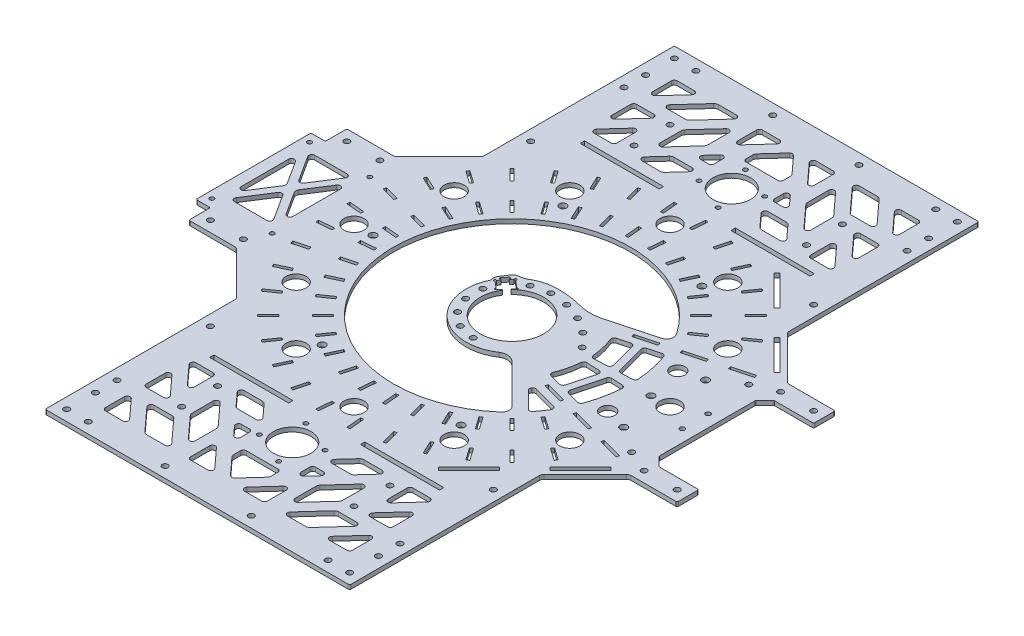
from build123d import *

# Parameters (mm, degrees)
EXTRUDE_2_OUTLINE_R   = 135
EXTRUDE_2_OUTLINE_R_2 = 2
EXTRUDE_2_OUTLINE_R_3 = 22.1
EXTRUDE_2_DEPTH       = 3
SKETCH_7_R            = 2.5
CUT_EXTRUDE_3_DEPTH   = 191.942399692
EXTRUDE_START         = -3
SKETCH_8_R            = 2
SKETCH_8_R_2          = 1.5
EXTRUDE_3_DEPTH       = 3
SKETCH_9_R            = 1.5
SKETCH_9_R_2          = 7
SKETCH_9_R_3          = 2.5
SKETCH_9_R_4          = 5
SKETCH_9_R_5          = 1.65
SKETCH_9_R_6          = 13.1
CUT_EXTRUDE_4_DEPTH   = 284.496031718
SKETCH_11_R           = 2
CUT_EXTRUDE_6_DEPTH   = 284.496031718
EXTRUDE_4_DEPTH       = 3
SKETCH_13_R           = 2
SKETCH_13_W           = 55
SKETCH_13_H           = 3
CUT_EXTRUDE_7_DEPTH   = 284.496031718
SKETCH_25_W           = 36
SKETCH_25_H           = 56
CUT_EXTRUDE_14_DEPTH  = 284.496031718
EXTRUDE_1_DEPTH       = 3
CUT_EXTRUDE_15_DEPTH  = 10
SKETCH_30_R           = 0.75
CUT_EXTRUDE_16_DEPTH  = 10
FILLET_1_R            = 3
FILLET_6_R            = 1
FILLET_8_R            = 2


with BuildPart() as part:
    # 凸台-拉伸2: read off the stored shape, not the designer's step
    # 凸台-拉伸2 outline → 凸台-拉伸2 (new body)
    with BuildSketch(Plane(origin=(0, 0, 0), x_dir=(1, 0, 0), z_dir=(0, 1, 0))):
        Circle(EXTRUDE_2_OUTLINE_R)
        with Locations((-11.714860956, -24.326159433)):
            Circle(EXTRUDE_2_OUTLINE_R_2, mode=Mode.SUBTRACT)
        with Locations((-21.109450027, -16.83422465)):
            Circle(EXTRUDE_2_OUTLINE_R_2, mode=Mode.SUBTRACT)
        with Locations((-26.323053629, -6.008065217)):
            Circle(EXTRUDE_2_OUTLINE_R_2, mode=Mode.SUBTRACT)
        with Locations((0, -27)):
            Circle(EXTRUDE_2_OUTLINE_R_2, mode=Mode.SUBTRACT)
        with Locations((-26.323053629, 6.008065217)):
            Circle(EXTRUDE_2_OUTLINE_R_2, mode=Mode.SUBTRACT)
        with Locations((-11.714860956, 24.326159433)):
            Circle(EXTRUDE_2_OUTLINE_R_2, mode=Mode.SUBTRACT)
        Circle(EXTRUDE_2_OUTLINE_R_3, mode=Mode.SUBTRACT)
        with Locations((0, 27)):
            Circle(EXTRUDE_2_OUTLINE_R_2, mode=Mode.SUBTRACT)
        with Locations((12.540402558, 25.523692784)):
            Circle(EXTRUDE_2_OUTLINE_R_2, mode=Mode.SUBTRACT)
        with Locations((24.405378925, 21.203563722)):
            Circle(EXTRUDE_2_OUTLINE_R_2, mode=Mode.SUBTRACT)
        with Locations((43.69592095, 5.163960916)):
            Circle(EXTRUDE_2_OUTLINE_R_2, mode=Mode.SUBTRACT)
        with Locations((34.97553353, 14.296103193)):
            Circle(EXTRUDE_2_OUTLINE_R_2, mode=Mode.SUBTRACT)
    extrude(amount=EXTRUDE_2_DEPTH)

    # 草图7 → 切除-拉伸3 (cut, through all)
    with BuildSketch(Plane(origin=(0, 3, 0), x_dir=(1, 0, 0), z_dir=(0, 1, 0))):
        with Locations(Location((96.75, 0, 0), (0, 0, 270))):
            Circle(SKETCH_7_R)
        with Locations(Location((48.375, -83.787957816, 0), (0, 0, 270))):
            Circle(SKETCH_7_R)
        with Locations(Location((-48.375, -83.787957816, 0), (0, 0, 270))):
            Circle(SKETCH_7_R)
        with Locations(Location((-96.75, 0, 0), (0, 0, 270))):
            Circle(SKETCH_7_R)
        with Locations(Location((-48.375, 83.787957816, 0), (0, 0, 270))):
            Circle(SKETCH_7_R)
        with Locations(Location((48.375, 83.787957816, 0), (0, 0, 270))):
            Circle(SKETCH_7_R)
        with BuildLine():
            Line((-23.944417996, 22.009220284), (-26.66858516, 18.812516785))
            Line((-26.66858516, 18.812516785), (-18.599424602, 11.936138592))
            ThreePointArc((-18.599424602, 11.936138592), (-17.380019908, 13.650820781), (-16.003077925, 15.241768169))
            Line((-16.003077925, 15.241768169), (-23.944417996, 22.009220284))
        make_face()
    extrude(amount=-CUT_EXTRUDE_3_DEPTH, mode=Mode.SUBTRACT)

    # 草图8 → 凸台-拉伸3 (add)
    # profile 1 of 4: a face of its own
    with BuildSketch(Plane(origin=(0, 3, 0), x_dir=(1, 0, 0), z_dir=(0, 1, 0)).offset(EXTRUDE_START)):
        with BuildLine():
            Line((123.288280059, 55), (170, 55))
            Line((170, 55), (170, 40))
            Line((170, 40), (142.5, 40))
            Line((142.5, 40), (136, 33.5))
            Line((136, 33.5), (136, -33.5))
            Line((136, -33.5), (142.5, -40))
            Line((142.5, -40), (170, -40))
            Line((170, -40), (170, -55))
            Line((170, -55), (123.288280059, -55))
            ThreePointArc((123.288280059, -55), (135, 0), (123.288280059, 55))
        make_face()
        with Locations(Location((162.5, 47.5, 0), (0, 0, 270))):
            Circle(SKETCH_8_R, mode=Mode.SUBTRACT)
        with Locations(Location((139.5, 47.5, 0), (0, 0, 270))):
            Circle(SKETCH_8_R, mode=Mode.SUBTRACT)
        with Locations(Location((139.5, -47.5, 0), (0, 0, 270))):
            Circle(SKETCH_8_R, mode=Mode.SUBTRACT)
        with Locations(Location((162.5, -47.5, 0), (0, 0, 270))):
            Circle(SKETCH_8_R, mode=Mode.SUBTRACT)
    # profile 2 of 4: a face of its own
    with BuildSketch(Plane(origin=(0, 3, 0), x_dir=(1, 0, 0), z_dir=(0, 1, 0)).offset(EXTRUDE_START)):
        with BuildLine():
            Line((-106, 83.600239234), (-106, 219))
            Line((-106, 219), (106, 219))
            Line((106, 219), (106, 83.600239234))
            ThreePointArc((106, 83.600239234), (0, 135), (-106, 83.600239234))
        make_face()
    # profile 3 of 4: a face of its own
    with BuildSketch(Plane(origin=(0, 3, 0), x_dir=(1, 0, 0), z_dir=(0, 1, 0)).offset(EXTRUDE_START)):
        with BuildLine():
            Line((106, -219), (106, -83.600239234))
            ThreePointArc((106, -83.600239234), (0, -135), (-106, -83.600239234))
            Line((-106, -83.600239234), (-106, -219))
            Line((-106, -219), (106, -219))
        make_face()
    # profile 4 of 4: a face of its own
    with BuildSketch(Plane(origin=(0, 3, 0), x_dir=(1, 0, 0), z_dir=(0, 1, 0)).offset(EXTRUDE_START)):
        with BuildLine():
            Line((-123.288280059, -55), (-170, -55))
            Line((-170, -55), (-170, -40))
            Line((-170, -40), (-180, -40))
            Line((-180, -40), (-180, 40))
            Line((-180, 40), (-170, 40))
            Line((-170, 40), (-170, 55))
            Line((-170, 55), (-123.288280059, 55))
            ThreePointArc((-123.288280059, 55), (-135, 0), (-123.288280059, -55))
        make_face()
        with Locations(Location((-162.5, -47.5, 0), (0, 0, 270))):
            Circle(SKETCH_8_R, mode=Mode.SUBTRACT)
        with Locations(Location((-139.5, -47.5, 0), (0, 0, 270))):
            Circle(SKETCH_8_R, mode=Mode.SUBTRACT)
        with Locations(Location((-139.5, 47.5, 0), (0, 0, 270))):
            Circle(SKETCH_8_R, mode=Mode.SUBTRACT)
        with Locations(Location((-162.5, 47.5, 0), (0, 0, 270))):
            Circle(SKETCH_8_R, mode=Mode.SUBTRACT)
        with Locations(Location((-175, 34, 0), (0, 0, 270))):
            Circle(SKETCH_8_R_2, mode=Mode.SUBTRACT)
        with Locations(Location((-175, -34, 0), (0, 0, 270))):
            Circle(SKETCH_8_R_2, mode=Mode.SUBTRACT)
        with Locations(Location((-133, -34, 0), (0, 0, 270))):
            Circle(SKETCH_8_R_2, mode=Mode.SUBTRACT)
        with Locations(Location((-133, 34, 0), (0, 0, 270))):
            Circle(SKETCH_8_R_2, mode=Mode.SUBTRACT)
    extrude(amount=EXTRUDE_3_DEPTH)

    # 草图9 → 切除-拉伸4 (cut, through all)
    with BuildSketch(Plane(origin=(0, 3, 0), x_dir=(1, 0, 0), z_dir=(0, 1, 0))):
        with Locations(Location((-6.696960066, 169.167891819, 0), (0, 0, 270))):
            Circle(SKETCH_9_R)
        with Locations(Location((0, 110, 0), (0, 0, 270))):
            Circle(SKETCH_9_R_2)
        with Locations(Location((106.251840892, 28.470094961, 0), (0, 0, 270))):
            Circle(SKETCH_9_R_3)
        with Locations(Location((55, 95.262794416, 0), (0, 0, 270))):
            Circle(SKETCH_9_R_2)
        with Locations(Location((91.038509128, 24.393695001, 0), (0, 0, 270))):
            Circle(SKETCH_9_R_4)
        with Locations(Location((91.038509128, -24.393695001, 0), (0, 0, 270))):
            Circle(SKETCH_9_R_4)
        with Locations(Location((106.251840892, -28.470094961, 0), (0, 0, 270))):
            Circle(SKETCH_9_R_3)
        with Locations(Location((95.262794416, 55, 0), (0, 0, 270))):
            Circle(SKETCH_9_R_2)
        with Locations(Location((110, 0, 0), (0, 0, 270))):
            Circle(SKETCH_9_R_2)
        with Locations(Location((95.262794416, -55, 0), (0, 0, 270))):
            Circle(SKETCH_9_R_2)
        with Locations(Location((55, -95.262794416, 0), (0, 0, 270))):
            Circle(SKETCH_9_R_2)
        with Locations(Location((0, -110, 0), (0, 0, 270))):
            Circle(SKETCH_9_R_2)
        with Locations(Location((-55, -95.262794416, 0), (0, 0, 270))):
            Circle(SKETCH_9_R_2)
        with Locations(Location((-95.262794416, -55, 0), (0, 0, 270))):
            Circle(SKETCH_9_R_2)
        with Locations(Location((-110, 0, 0), (0, 0, 270))):
            Circle(SKETCH_9_R_2)
        with Locations(Location((-95.262794416, 55, 0), (0, 0, 270))):
            Circle(SKETCH_9_R_2)
        with Locations(Location((-55, 95.262794416, 0), (0, 0, 270))):
            Circle(SKETCH_9_R_2)
        with Locations(Location((127.5, 9, 0), (0, 0, 270))):
            Circle(SKETCH_9_R_5)
        with Locations(Location((127.5, -9, 0), (0, 0, 270))):
            Circle(SKETCH_9_R_5)
        with Locations(Location((0, 153, 0), (0, 0, 270))):
            Circle(SKETCH_9_R_6)
        with Locations(Location((16.167891819, 159.696960066, 0), (0, 0, 270))):
            Circle(SKETCH_9_R)
        with Locations(Location((6.696960066, 136.832108181, 0), (0, 0, 270))):
            Circle(SKETCH_9_R)
        with Locations(Location((-16.167891819, 146.303039934, 0), (0, 0, 270))):
            Circle(SKETCH_9_R)
        with Locations(Location((-6.696960066, -136.832108181, 0), (0, 0, 270))):
            Circle(SKETCH_9_R)
        with Locations(Location((0, -153, 0), (0, 0, 270))):
            Circle(SKETCH_9_R_6)
        with Locations(Location((16.167891819, -146.303039934, 0), (0, 0, 270))):
            Circle(SKETCH_9_R)
        with Locations(Location((6.696960066, -169.167891819, 0), (0, 0, 270))):
            Circle(SKETCH_9_R)
        with Locations(Location((-16.167891819, -159.696960066, 0), (0, 0, 270))):
            Circle(SKETCH_9_R)
        with BuildLine():
            Line((33.521217387, 29.648283731), (65.703310504, 38.271449593))
            ThreePointArc((65.703310504, 38.271449593), (69.089351351, 41.341440596), (68.564648523, 45.88179348))
            ThreePointArc((68.564648523, 45.88179348), (-81.802671016, 10.703878487), (54.45114247, -61.978408205))
            ThreePointArc((54.45114247, -61.978408205), (56.148468382, -58.383515435), (54.686607136, -54.686607136))
            Line((54.686607136, -54.686607136), (27.712812921, -27.712812921))
            ThreePointArc((27.712812921, -27.712812921), (22.860030368, -25.410177947), (17.644766937, -26.695733736))
            ThreePointArc((17.644766937, -26.695733736), (-21.048434027, -24.103182881), (-28.829108868, 13.888213775))
            ThreePointArc((-28.829108868, 13.888213775), (-28.782435247, 14.075330073), (-28.814021115, 14.265575358))
            ThreePointArc((-28.814021115, 14.265575358), (-29.122939909, 16.594282895), (-28.334302935, 18.807055213))
            Line((-28.334302935, 18.807055213), (-25.048700438, 23.827495058))
            ThreePointArc((-25.048700438, 23.827495058), (-23.336585416, 25.435901649), (-21.078911577, 26.08491509))
            ThreePointArc((-21.078911577, 26.08491509), (-18.645378551, 26.493867679), (-16.386082739, 27.486292811))
            ThreePointArc((-16.386082739, 27.486292811), (-8.49819481, 30.850943016), (0, 32))
            ThreePointArc((0, 32), (9.091840642, 31.407048876), (18.029652224, 29.638240964))
            ThreePointArc((18.029652224, 29.638240964), (25.776094228, 28.626064824), (33.521217387, 29.648283731))
        make_face()
    extrude(amount=-CUT_EXTRUDE_4_DEPTH, mode=Mode.SUBTRACT)

    # 草图11 → 切除-拉伸6 (cut, through all)
    with BuildSketch(Plane(origin=(0, 3, 0), x_dir=(1, 0, 0), z_dir=(0, 1, 0))):
        with Locations(Location((124.017821778, -40.783850417, 0), (0, 0, 270))):
            Circle(SKETCH_11_R)
        with Locations(Location((124.017821778, 40.783850417, 0), (0, 0, 90))):
            Circle(SKETCH_11_R)
        Polygon((72.495125925, -49.540859067), (81.014307186, -55.506054005), (79.867154313, -57.144358094), (71.347973052, -51.179163156), align=None)
        Polygon((94.612231121, -65.027422849), (103.131412381, -70.992617787), (101.984259509, -72.630921875), (93.465078248, -66.665726937), align=None)
        Polygon((62.791082169, -61.376868607), (70.144992694, -68.730779131), (68.730779131, -70.144992694), (61.376868607, -62.791082169), align=None)
        Polygon((81.882965261, -80.468751699), (89.236875786, -87.822662223), (87.822662223, -89.236875786), (80.468751699, -81.882965261), align=None)
        Polygon((51.179163156, -71.347973052), (57.144358094, -79.867154313), (55.506054005, -81.014307186), (49.540859067, -72.495125925), align=None)
        Polygon((66.665726937, -93.465078248), (72.630921875, -101.984259509), (70.992617787, -103.131412381), (65.027422849, -94.612231121), align=None)
        Polygon((38.012191168, -79.15120544), (42.40742109, -88.576806425), (40.594805516, -89.422042949), (36.199575594, -79.996441964), align=None)
        Polygon((49.422884235, -103.62151569), (53.818114157, -113.047116675), (52.005498583, -113.892353199), (47.610268661, -104.466752214), align=None)
        Polygon((23.690237986, -84.549468503), (26.381956055, -94.595097096), (24.450104403, -95.112735187), (21.758386334, -85.067106593), align=None)
        Polygon((30.678352204, -110.629465813), (33.370070273, -120.675094406), (31.438218621, -121.192732496), (28.746500551, -111.147103903), align=None)
        Polygon((8.648468911, -87.37873875), (9.554888636, -97.73916361), (7.56249924, -97.913475095), (6.656079515, -87.553050235), align=None)
        Polygon((11.001673966, -114.275995598), (11.90809369, -124.636420458), (9.915704294, -124.810731944), (9.009284569, -114.450307084), align=None)
        Polygon((-6.656079515, -87.553050235), (-7.56249924, -97.913475095), (-9.554888636, -97.73916361), (-8.648468911, -87.37873875), align=None)
        Polygon((-9.009284569, -114.450307084), (-9.915704294, -124.810731944), (-11.90809369, -124.636420458), (-11.001673966, -114.275995598), align=None)
        Polygon((-21.758386334, -85.067106593), (-24.450104403, -95.112735187), (-26.381956055, -94.595097096), (-23.690237986, -84.549468503), align=None)
        Polygon((-28.746500551, -111.147103903), (-31.438218621, -121.192732496), (-33.370070273, -120.675094406), (-30.678352204, -110.629465813), align=None)
        Polygon((-36.199575594, -79.996441964), (-40.594805516, -89.422042949), (-42.40742109, -88.576806425), (-38.012191168, -79.15120544), align=None)
        Polygon((-47.610268661, -104.466752214), (-52.005498583, -113.892353199), (-53.818114157, -113.047116675), (-49.422884235, -103.62151569), align=None)
        Polygon((-49.540859067, -72.495125925), (-55.506054005, -81.014307186), (-57.144358094, -79.867154313), (-51.179163156, -71.347973052), align=None)
        Polygon((-65.027422849, -94.612231121), (-70.992617787, -103.131412381), (-72.630921875, -101.984259509), (-66.665726937, -93.465078248), align=None)
        Polygon((-61.376868607, -62.791082169), (-68.730779131, -70.144992694), (-70.144992694, -68.730779131), (-62.791082169, -61.376868607), align=None)
        Polygon((-80.468751699, -81.882965261), (-87.822662223, -89.236875786), (-89.236875786, -87.822662223), (-81.882965261, -80.468751699), align=None)
        Polygon((-71.347973052, -51.179163156), (-79.867154313, -57.144358094), (-81.014307186, -55.506054005), (-72.495125925, -49.540859067), align=None)
        Polygon((-93.465078248, -66.665726937), (-101.984259509, -72.630921875), (-103.131412381, -70.992617787), (-94.612231121, -65.027422849), align=None)
        Polygon((-79.15120544, -38.012191168), (-88.576806425, -42.40742109), (-89.422042949, -40.594805516), (-79.996441964, -36.199575594), align=None)
        Polygon((-103.62151569, -49.422884235), (-113.047116675, -53.818114157), (-113.892353199, -52.005498583), (-104.466752214, -47.610268661), align=None)
        Polygon((-84.549468503, -23.690237986), (-94.595097096, -26.381956055), (-95.112735187, -24.450104403), (-85.067106593, -21.758386334), align=None)
        Polygon((-110.629465813, -30.678352204), (-120.675094406, -33.370070273), (-121.192732496, -31.438218621), (-111.147103903, -28.746500551), align=None)
        Polygon((-87.37873875, -8.648468911), (-97.73916361, -9.554888636), (-97.913475095, -7.56249924), (-87.553050235, -6.656079515), align=None)
        Polygon((-114.275995598, -11.001673966), (-124.636420458, -11.90809369), (-124.810731944, -9.915704294), (-114.450307084, -9.009284569), align=None)
        Polygon((-87.553050235, 6.656079515), (-97.913475095, 7.56249924), (-97.73916361, 9.554888636), (-87.37873875, 8.648468911), align=None)
        Polygon((-114.450307084, 9.009284569), (-124.810731944, 9.915704294), (-124.636420458, 11.90809369), (-114.275995598, 11.001673966), align=None)
        Polygon((-85.067106593, 21.758386334), (-95.112735187, 24.450104403), (-94.595097096, 26.381956055), (-84.549468503, 23.690237986), align=None)
        Polygon((-111.147103903, 28.746500551), (-121.192732496, 31.438218621), (-120.675094406, 33.370070273), (-110.629465813, 30.678352204), align=None)
        Polygon((-79.996441964, 36.199575594), (-89.422042949, 40.594805516), (-88.576806425, 42.40742109), (-79.15120544, 38.012191168), align=None)
        Polygon((-104.466752214, 47.610268661), (-113.892353199, 52.005498583), (-113.047116675, 53.818114157), (-103.62151569, 49.422884235), align=None)
        Polygon((-72.495125925, 49.540859067), (-81.014307186, 55.506054005), (-79.867154313, 57.144358094), (-71.347973052, 51.179163156), align=None)
        Polygon((-94.612231121, 65.027422849), (-103.131412381, 70.992617787), (-101.984259509, 72.630921875), (-93.465078248, 66.665726937), align=None)
        Polygon((-62.791082169, 61.376868607), (-70.144992694, 68.730779131), (-68.730779131, 70.144992694), (-61.376868607, 62.791082169), align=None)
        Polygon((-81.882965261, 80.468751699), (-89.236875786, 87.822662223), (-87.822662223, 89.236875786), (-80.468751699, 81.882965261), align=None)
        Polygon((-51.179163156, 71.347973052), (-57.144358094, 79.867154313), (-55.506054005, 81.014307186), (-49.540859067, 72.495125925), align=None)
        Polygon((-66.665726937, 93.465078248), (-72.630921875, 101.984259509), (-70.992617787, 103.131412381), (-65.027422849, 94.612231121), align=None)
        Polygon((-38.012191168, 79.15120544), (-42.40742109, 88.576806425), (-40.594805516, 89.422042949), (-36.199575594, 79.996441964), align=None)
        Polygon((-49.422884235, 103.62151569), (-53.818114157, 113.047116675), (-52.005498583, 113.892353199), (-47.610268661, 104.466752214), align=None)
        Polygon((-23.690237986, 84.549468503), (-26.381956055, 94.595097096), (-24.450104403, 95.112735187), (-21.758386334, 85.067106593), align=None)
        Polygon((-30.678352204, 110.629465813), (-33.370070273, 120.675094406), (-31.438218621, 121.192732496), (-28.746500551, 111.147103903), align=None)
        Polygon((-8.648468911, 87.37873875), (-9.554888636, 97.73916361), (-7.56249924, 97.913475095), (-6.656079515, 87.553050235), align=None)
        Polygon((-11.001673966, 114.275995598), (-11.90809369, 124.636420458), (-9.915704294, 124.810731944), (-9.009284569, 114.450307084), align=None)
        Polygon((6.656079515, 87.553050235), (7.56249924, 97.913475095), (9.554888636, 97.73916361), (8.648468911, 87.37873875), align=None)
        Polygon((9.009284569, 114.450307084), (9.915704294, 124.810731944), (11.90809369, 124.636420458), (11.001673966, 114.275995598), align=None)
        Polygon((21.758386334, 85.067106593), (24.450104403, 95.112735187), (26.381956055, 94.595097096), (23.690237986, 84.549468503), align=None)
        Polygon((28.746500551, 111.147103903), (31.438218621, 121.192732496), (33.370070273, 120.675094406), (30.678352204, 110.629465813), align=None)
        Polygon((36.199575594, 79.996441964), (40.594805516, 89.422042949), (42.40742109, 88.576806425), (38.012191168, 79.15120544), align=None)
        Polygon((47.610268661, 104.466752214), (52.005498583, 113.892353199), (53.818114157, 113.047116675), (49.422884235, 103.62151569), align=None)
        Polygon((49.540859067, 72.495125925), (55.506054005, 81.014307186), (57.144358094, 79.867154313), (51.179163156, 71.347973052), align=None)
        Polygon((65.027422849, 94.612231121), (70.992617787, 103.131412381), (72.630921875, 101.984259509), (66.665726937, 93.465078248), align=None)
        Polygon((61.376868607, 62.791082169), (68.730779131, 70.144992694), (70.144992694, 68.730779131), (62.791082169, 61.376868607), align=None)
        Polygon((80.468751699, 81.882965261), (87.822662223, 89.236875786), (89.236875786, 87.822662223), (81.882965261, 80.468751699), align=None)
        Polygon((71.347973052, 51.179163156), (79.867154313, 57.144358094), (81.014307186, 55.506054005), (72.495125925, 49.540859067), align=None)
        Polygon((93.465078248, 66.665726937), (101.984259509, 72.630921875), (103.131412381, 70.992617787), (94.612231121, 65.027422849), align=None)
        Polygon((53.824250607, 30.947360365), (68.313138001, 34.829646041), (68.830776092, 32.897794389), (54.341888697, 29.015508712), align=None)
        Polygon((54.341888697, -29.015508712), (68.830776092, -32.897794389), (68.313138001, -34.829646041), (53.824250607, -30.947360365), align=None)
        Polygon((80.38721083, 38.064884105), (94.876098224, 41.947169781), (95.393736315, 40.015318129), (80.90484892, 36.133032452), align=None)
        Polygon((106.950171053, 45.182407845), (121.439058447, 49.064693522), (121.956696537, 47.132841869), (107.467809143, 43.250556193), align=None)
        Polygon((106.950171053, -45.182407845), (107.467809143, -43.250556193), (121.956696537, -47.132841869), (121.439058447, -49.064693522), align=None)
        Polygon((80.38721083, -38.064884105), (80.90484892, -36.133032452), (95.393736315, -40.015318129), (94.876098224, -41.947169781), align=None)
    extrude(amount=-CUT_EXTRUDE_6_DEPTH, mode=Mode.SUBTRACT)

    # 草图12 → 凸台-拉伸4 (add)
    with BuildSketch(Plane(origin=(0, 3, 0), x_dir=(1, 0, 0), z_dir=(0, 1, 0)).offset(EXTRUDE_START)):
        with BuildLine():
            Line((106, 85.625937702), (136.625937702, 55))
            Line((136.625937702, 55), (123.288280059, 55))
            ThreePointArc((123.288280059, 55), (115.532559325, 69.837151544), (106, 83.600239234))
            Line((106, 83.600239234), (106, 85.625937702))
        make_face()
        with BuildLine():
            Line((106, -85.625937702), (136.625937702, -55))
            Line((136.625937702, -55), (123.288280059, -55))
            ThreePointArc((123.288280059, -55), (115.532559325, -69.837151544), (106, -83.600239234))
            Line((106, -83.600239234), (106, -85.625937702))
        make_face()
        with BuildLine():
            Line((-106, -85.625937702), (-106, -83.600239234))
            ThreePointArc((-106, -83.600239234), (-115.532559325, -69.837151544), (-123.288280059, -55))
            Line((-123.288280059, -55), (-136.625937702, -55))
            Line((-136.625937702, -55), (-106, -85.625937702))
        make_face()
        with BuildLine():
            Line((-136.625937702, 55), (-123.288280059, 55))
            ThreePointArc((-123.288280059, 55), (-115.532559325, 69.837151544), (-106, 83.600239234))
            Line((-106, 83.600239234), (-106, 85.625937702))
            Line((-106, 85.625937702), (-136.625937702, 55))
        make_face()
    extrude(amount=EXTRUDE_4_DEPTH)

    # 草图13 → 切除-拉伸7 (cut, through all)
    with BuildSketch(Plane(origin=(0, 3, 0), x_dir=(1, 0, 0), z_dir=(0, 1, 0))):
        with Locations(Location((98.5, -111.5, 0), (0, 0, 90))):
            Circle(SKETCH_13_R)
        with Locations(Location((98.5, 211.5, 0), (0, 0, 270))):
            Circle(SKETCH_13_R)
        with Locations(Location((60, 145, 0), (0, 0, 270))):
            Circle(SKETCH_13_R)
        with Locations(Location((-60, 145, 0), (0, 0, 270))):
            Circle(SKETCH_13_R)
        with Locations(Location((-60, 170, 0), (0, 0, 270))):
            Circle(SKETCH_13_R)
        with Locations(Location((60, 170, 0), (0, 0, 270))):
            Circle(SKETCH_13_R)
        with Locations(Location((-60, -170, 0), (0, 0, 90))):
            Circle(SKETCH_13_R)
        with Locations(Location((-60, -145, 0), (0, 0, 90))):
            Circle(SKETCH_13_R)
        with Locations(Location((60, -170, 0), (0, 0, 90))):
            Circle(SKETCH_13_R)
        with Locations(Location((60, -145, 0), (0, 0, 90))):
            Circle(SKETCH_13_R)
        with Locations(Location((98.5, -176.5, 0), (0, 0, 90))):
            Circle(SKETCH_13_R)
        with Locations(Location((98.5, 191.5, 0), (0, 0, 270))):
            Circle(SKETCH_13_R)
        with Locations(Location((98.5, 176.5, 0), (0, 0, 270))):
            Circle(SKETCH_13_R)
        with Locations(Location((98.5, 111.5, 0), (0, 0, 270))):
            Circle(SKETCH_13_R)
        with Locations(Location((83.5, -211.5, 0), (0, 0, 90))):
            Circle(SKETCH_13_R)
        with Locations(Location((83.5, 211.5, 0), (0, 0, 270))):
            Circle(SKETCH_13_R)
        with Locations(Location((98.5, -191.5, 0), (0, 0, 90))):
            Circle(SKETCH_13_R)
        with Locations(Location((30, 211.5, 0), (0, 0, 270))):
            Circle(SKETCH_13_R)
        with Locations(Location((-98.5, 111.5, 0), (0, 0, 90))):
            Circle(SKETCH_13_R)
        with Locations(Location((-98.5, 176.5, 0), (0, 0, 90))):
            Circle(SKETCH_13_R)
        with Locations(Location((-98.5, 191.5, 0), (0, 0, 90))):
            Circle(SKETCH_13_R)
        with Locations(Location((-30, 211.5, 0), (0, 0, 90))):
            Circle(SKETCH_13_R)
        with Locations(Location((-83.5, 211.5, 0), (0, 0, 90))):
            Circle(SKETCH_13_R)
        with Locations(Location((-98.5, 211.5, 0), (0, 0, 90))):
            Circle(SKETCH_13_R)
        with Locations(Location((98.5, -211.5, 0), (0, 0, 90))):
            Circle(SKETCH_13_R)
        with Locations(Location((-30, -211.5, 0), (0, 0, 270))):
            Circle(SKETCH_13_R)
        with Locations(Location((30, -211.5, 0), (0, 0, 90))):
            Circle(SKETCH_13_R)
        with Locations(Location((-98.5, -176.5, 0), (0, 0, 270))):
            Circle(SKETCH_13_R)
        with Locations(Location((-98.5, -111.5, 0), (0, 0, 270))):
            Circle(SKETCH_13_R)
        with Locations(Location((-98.5, -211.5, 0), (0, 0, 270))):
            Circle(SKETCH_13_R)
        with Locations(Location((-83.5, -211.5, 0), (0, 0, 270))):
            Circle(SKETCH_13_R)
        with Locations(Location((-98.5, -191.5, 0), (0, 0, 270))):
            Circle(SKETCH_13_R)
        Polygon((65.606601718, 116.893398282), (86.819805153, 95.680194847), (88.941125497, 97.80151519), (67.727922061, 119.014718626), align=None)
        with Locations((-52.5, 129)):
            Rectangle(SKETCH_13_W, SKETCH_13_H)
        with Locations((52.5, 129)):
            Rectangle(SKETCH_13_W, SKETCH_13_H)
        Polygon((104.497474683, 78.002525317), (125.710678119, 56.789321881), (127.831998462, 58.910642225), (106.618795027, 80.123845661), align=None)
        Polygon((106.618795027, -80.123845661), (127.831998462, -58.910642225), (125.710678119, -56.789321881), (104.497474683, -78.002525317), align=None)
        Polygon((67.727922061, -119.014718626), (88.941125497, -97.80151519), (86.819805153, -95.680194847), (65.606601718, -116.893398282), align=None)
        with Locations((52.5, -129)):
            Rectangle(SKETCH_13_W, SKETCH_13_H)
        with Locations((-52.5, -129)):
            Rectangle(SKETCH_13_W, SKETCH_13_H)
    extrude(amount=-CUT_EXTRUDE_7_DEPTH, mode=Mode.SUBTRACT)

    # 草图25 → 切除-拉伸14 (cut, through all)
    with BuildSketch(Plane(origin=(0, 3, 0), x_dir=(1, 0, 0), z_dir=(0, 1, 0))):
        Polygon((-86, 199), (-86, 178.690026612), (-67.5, 199), align=None)
        Polygon((13, -181.864537774), (0, -196.136410965), (-13, -181.864537774), (-13, -174), (13, -174), align=None)
        Polygon((-75.178667029, 178.690026612), (-56.678667029, 199), (-38.178667029, 199), (-56.678667029, 178.690026612), align=None)
        Polygon((-86, 170.690026612), (-67.5, 170.690026612), (-86, 150.380053225), align=None)
        Polygon((-67.5, 158.809973388), (-86, 138.5), (-67.5, 138.5), align=None)
        Polygon((-52.5, 171.397466153), (-52.5, 150.380053225), (-34.712939738, 169.907335418), (-34.712939738, 190.924748346), align=None)
        Polygon((-52.5, 138.5), (-34, 138.5), (-21.893530131, 151.79092329), (-40.393530131, 151.79092329), align=None)
        Polygon((-33.106469869, 159.79092329), (-21, 159.79092329), (-21, 173.081846579), align=None)
        Polygon((-26.712939738, 199), (-8.212939738, 199), (-26.712939738, 178.690026612), align=None)
        Polygon((26.712939738, 178.690026612), (26.712939738, 199), (8.212939738, 199), align=None)
        Polygon((21, 173.081846579), (33.106469869, 159.79092329), (21, 159.79092329), align=None)
        Polygon((40.393530131, 151.79092329), (52.5, 138.5), (34, 138.5), (21.893530131, 151.79092329), align=None)
        Polygon((34.712939738, 190.924748346), (52.5, 171.397466153), (52.5, 150.380053225), (34.712939738, 169.907335418), align=None)
        Polygon((67.5, 138.5), (67.5, 158.809973388), (86, 138.5), align=None)
        Polygon((86, 150.380053225), (86, 170.690026612), (67.5, 170.690026612), align=None)
        Polygon((56.678667029, 178.690026612), (75.178667029, 178.690026612), (56.678667029, 199), (38.178667029, 199), align=None)
        Polygon((67.5, 199), (86, 199), (86, 178.690026612), align=None)
        Polygon((-13, 181.864537774), (-13, 174), (13, 174), (13, 181.864537774), (0, 196.136410965), align=None)
        Polygon((26.712939738, -199), (8.212939738, -199), (26.712939738, -178.690026612), align=None)
        Polygon((86, -199), (86, -178.690026612), (67.5, -199), align=None)
        Polygon((75.178667029, -178.690026612), (56.678667029, -199), (38.178667029, -199), (56.678667029, -178.690026612), align=None)
        Polygon((86, -170.690026612), (67.5, -170.690026612), (86, -150.380053225), align=None)
        Polygon((67.5, -158.809973388), (86, -138.5), (67.5, -138.5), align=None)
        Polygon((52.5, -171.397466153), (52.5, -150.380053225), (34.712939738, -169.907335418), (34.712939738, -190.924748346), align=None)
        Polygon((52.5, -138.5), (34, -138.5), (21.893530131, -151.79092329), (40.393530131, -151.79092329), align=None)
        Polygon((33.106469869, -159.79092329), (21, -159.79092329), (21, -173.081846579), align=None)
        Polygon((-26.712939738, -178.690026612), (-26.712939738, -199), (-8.212939738, -199), align=None)
        Polygon((-21, -173.081846579), (-33.106469869, -159.79092329), (-21, -159.79092329), align=None)
        Polygon((-40.393530131, -151.79092329), (-52.5, -138.5), (-34, -138.5), (-21.893530131, -151.79092329), align=None)
        Polygon((-34.712939738, -190.924748346), (-52.5, -171.397466153), (-52.5, -150.380053225), (-34.712939738, -169.907335418), align=None)
        Polygon((-67.5, -138.5), (-67.5, -158.809973388), (-86, -138.5), align=None)
        Polygon((-86, -150.380053225), (-86, -170.690026612), (-67.5, -170.690026612), align=None)
        Polygon((-56.678667029, -178.690026612), (-75.178667029, -178.690026612), (-56.678667029, -199), (-38.178667029, -199), align=None)
        Polygon((-67.5, -199), (-86, -199), (-86, -178.690026612), align=None)
        with Locations((-154, 0)):
            Rectangle(SKETCH_25_W, SKETCH_25_H)
        with BuildLine():
            Line((47.64719496, 22.045290029), (76.897721657, 29.882945036))
            ThreePointArc((76.897721657, 29.882945036), (80.736414168, 16.967068905), (82.421478281, 3.598599458))
            Line((82.421478281, 3.598599458), (52.450031633, 2.290017837))
            ThreePointArc((52.450031633, 2.290017837), (51.014031283, 12.402363172), (47.64719496, 22.045290029))
        make_face()
        with BuildLine():
            Line((52.450031633, -2.290017837), (82.421478281, -3.598599458))
            ThreePointArc((82.421478281, -3.598599458), (80.736414168, -16.967068905), (76.897721657, -29.882945036))
            Line((76.897721657, -29.882945036), (47.64719496, -22.045290029))
            ThreePointArc((47.64719496, -22.045290029), (51.014031283, -12.402363172), (52.450031633, -2.290017837))
        make_face()
        with BuildLine():
            Line((49.487494217, -38.173785718), (63.718244174, -52.404535675))
            ThreePointArc((63.718244174, -52.404535675), (67.927245052, -46.82028812), (71.648222578, -40.899660162))
            Line((71.648222578, -40.899660162), (51.448198685, -35.487080073))
            ThreePointArc((51.448198685, -35.487080073), (50.485721964, -36.84347809), (49.487494217, -38.173785718))
        make_face()
    extrude(amount=-CUT_EXTRUDE_14_DEPTH, mode=Mode.SUBTRACT)

    # 草图26 → Extrude 1 (add)
    with BuildSketch(Plane(origin=(0, 3, 0), x_dir=(1, 0, 0), z_dir=(0, 1, 0))):
        Polygon((-133.897053812, -26.648106022), (-169.897053812, 29.351893978), (-174.102946188, 26.648106022), (-138.102946188, -29.351893978), align=None)
        Polygon((-169.897053812, -29.351893978), (-133.897053812, 26.648106022), (-138.102946188, 29.351893978), (-174.102946188, -26.648106022), align=None)
        Polygon((59.857643742, 25.31706992), (66.641332182, 0), (59.857643742, -25.31706992), (64.687272874, -26.611165145), (71.817713084, 0), (64.687272874, 26.611165145), align=None)
    extrude(amount=-EXTRUDE_1_DEPTH)

    # 草图28 → 切除-拉伸15 (cut)
    with BuildSketch(Plane(origin=(0, 3, 0), x_dir=(1, 0, 0), z_dir=(0, 1, 0))):
        Polygon((-22.422178234, 20.711997825), (-24.096641972, 22.13894253), (-26.820809136, 18.942239031), (-25.146345398, 17.515294326), (-27.092179087, 15.231934683), (-21.00322004, 10.043044847), (-19.057386352, 12.32640449), (-18.599424602, 11.936138592), (-16.003077925, 15.241768169), (-16.333219188, 15.523107989), (-14.387385499, 17.806467631), (-20.476344546, 22.995357468), align=None)
    extrude(amount=-CUT_EXTRUDE_15_DEPTH, mode=Mode.SUBTRACT)

    # 草图30 → 切除-拉伸16 (cut)
    with BuildSketch(Plane(origin=(0, 3, 0), x_dir=(1, 0, 0), z_dir=(0, 1, 0))):
        with Locations((-20.476344546, 22.995357468)):
            Circle(SKETCH_30_R)
        with Locations((-14.387385499, 17.806467631)):
            Circle(SKETCH_30_R)
        with Locations((-27.092179087, 15.231934683)):
            Circle(SKETCH_30_R)
        with Locations((-26.249969225, 18.455780609)):
            Circle(SKETCH_30_R)
        with Locations((-23.525802061, 21.652484108)):
            Circle(SKETCH_30_R)
        with Locations((-21.574059951, 10.529503269)):
            Circle(SKETCH_30_R)
    extrude(amount=-CUT_EXTRUDE_16_DEPTH, mode=Mode.SUBTRACT)

    # 圆角1
    fillet_1_edges = [part.edges().sort_by_distance(p)[0] for p in [
        (106, 1.5, -85.625937702),
        (136.625937702, 1.5, -55),
        (106, 1.5, 85.625937702),
        (136.625937702, 1.5, 55),
        (-136.625937702, 1.5, -55),
        (-106, 1.5, -85.625937702),
        (-106, 1.5, 85.625937702),
        (-136.625937702, 1.5, 55),
        (34.712939738, 1.5, -169.907335418),
        (52.5, 1.5, -171.397466153),
        (40.393530131, 1.5, -151.79092329),
        (34, 1.5, -138.5),
        (-13, 1.5, -181.864537774),
        (13, 1.5, -181.864537774),
        (56.678667029, 1.5, -178.690026612),
        (56.678667029, 1.5, -199),
        (-34.712939738, 1.5, -169.907335418),
        (-52.5, 1.5, -171.397466153),
        (-56.678667029, 1.5, -178.690026612),
        (-56.678667029, 1.5, -199),
        (-40.393530131, 1.5, -151.79092329),
        (-34, 1.5, -138.5),
        (40.393530131, 1.5, 151.79092329),
        (34, 1.5, 138.5),
        (-34.712939738, 1.5, 169.907335418),
        (-52.5, 1.5, 171.397466153),
        (-40.393530131, 1.5, 151.79092329),
        (-34, 1.5, 138.5),
        (13, 1.5, 181.864537774),
        (-13, 1.5, 181.864537774),
        (52.5, 1.5, 171.397466153),
        (34.712939738, 1.5, 169.907335418),
        (56.678667029, 1.5, 178.690026612),
        (56.678667029, 1.5, 199),
        (-56.678667029, 1.5, 178.690026612),
        (-56.678667029, 1.5, 199),
        (-156.972020889, 1.5, 0),
        (-151.027979111, 1.5, 0),
    ]]
    fillet(fillet_1_edges, radius=FILLET_1_R)

    # 圆角6
    fillet_6_edges = [part.edges().sort_by_distance(p)[0] for p in [
        (170, 1.5, 55),
        (170, 1.5, 40),
        (142.5, 1.5, 40),
        (136, 1.5, 33.5),
        (136, 1.5, -33.5),
        (142.5, 1.5, -40),
        (170, 1.5, -40),
        (170, 1.5, -55),
        (-106, 1.5, -219),
        (106, 1.5, -219),
        (106, 1.5, 219),
        (-106, 1.5, 219),
        (-170, 1.5, -55),
        (-170, 1.5, -40),
        (-180, 1.5, -40),
        (-180, 1.5, 40),
        (-170, 1.5, 40),
        (-170, 1.5, 55),
    ]]
    fillet(fillet_6_edges, radius=FILLET_6_R)

    # 圆角8
    fillet_8_edges = [part.edges().sort_by_distance(p)[0] for p in [
        (86, 1.5, -138.5),
        (67.5, 1.5, -138.5),
        (67.5, 1.5, -158.809973388),
        (34.712939738, 1.5, -190.924748346),
        (52.5, 1.5, -150.380053225),
        (21.893530131, 1.5, -151.79092329),
        (52.5, 1.5, -138.5),
        (21, 1.5, -159.79092329),
        (21, 1.5, -173.081846579),
        (33.106469869, 1.5, -159.79092329),
        (0, 1.5, -196.136410965),
        (13, 1.5, -174),
        (-13, 1.5, -174),
        (86, 1.5, -178.690026612),
        (67.5, 1.5, -199),
        (86, 1.5, -199),
        (38.178667029, 1.5, -199),
        (75.178667029, 1.5, -178.690026612),
        (86, 1.5, -150.380053225),
        (67.5, 1.5, -170.690026612),
        (86, 1.5, -170.690026612),
        (-34.712939738, 1.5, -190.924748346),
        (-52.5, 1.5, -150.380053225),
        (-67.5, 1.5, -158.809973388),
        (-67.5, 1.5, -138.5),
        (-86, 1.5, -138.5),
        (-86, 1.5, -150.380053225),
        (-86, 1.5, -170.690026612),
        (-67.5, 1.5, -170.690026612),
        (-75.178667029, 1.5, -178.690026612),
        (-38.178667029, 1.5, -199),
        (-52.5, 1.5, -138.5),
        (-21.893530131, 1.5, -151.79092329),
        (-33.106469869, 1.5, -159.79092329),
        (-21, 1.5, -173.081846579),
        (-21, 1.5, -159.79092329),
        (-26.712939738, 1.5, -178.690026612),
        (-26.712939738, 1.5, -199),
        (-8.212939738, 1.5, -199),
        (26.712939738, 1.5, -178.690026612),
        (8.212939738, 1.5, -199),
        (26.712939738, 1.5, -199),
        (52.5, 1.5, 138.5),
        (21.893530131, 1.5, 151.79092329),
        (33.106469869, 1.5, 159.79092329),
        (21, 1.5, 173.081846579),
        (21, 1.5, 159.79092329),
        (-26.712939738, 1.5, 178.690026612),
        (-8.212939738, 1.5, 199),
        (-26.712939738, 1.5, 199),
        (-21, 1.5, 159.79092329),
        (-21, 1.5, 173.081846579),
        (-33.106469869, 1.5, 159.79092329),
        (-34.712939738, 1.5, 190.924748346),
        (-52.5, 1.5, 150.380053225),
        (-21.893530131, 1.5, 151.79092329),
        (-52.5, 1.5, 138.5),
        (-86, 1.5, 150.380053225),
        (-67.5, 1.5, 170.690026612),
        (-86, 1.5, 170.690026612),
        (-86, 1.5, 138.5),
        (-67.5, 1.5, 138.5),
        (-67.5, 1.5, 158.809973388),
        (86, 1.5, 199),
        (67.5, 1.5, 199),
        (86, 1.5, 178.690026612),
        (26.712939738, 1.5, 178.690026612),
        (26.712939738, 1.5, 199),
        (8.212939738, 1.5, 199),
        (13, 1.5, 174),
        (0, 1.5, 196.136410965),
        (-13, 1.5, 174),
        (34.712939738, 1.5, 190.924748346),
        (52.5, 1.5, 150.380053225),
        (67.5, 1.5, 158.809973388),
        (67.5, 1.5, 138.5),
        (86, 1.5, 138.5),
        (86, 1.5, 150.380053225),
        (86, 1.5, 170.690026612),
        (67.5, 1.5, 170.690026612),
        (75.178667029, 1.5, 178.690026612),
        (38.178667029, 1.5, 199),
        (-86, 1.5, 178.690026612),
        (-67.5, 1.5, 199),
        (-86, 1.5, 199),
        (-38.178667029, 1.5, 199),
        (-75.178667029, 1.5, 178.690026612),
        (82.421478281, 1.5, 3.598599458),
        (76.897721657, 1.5, 29.882945036),
        (47.64719496, 1.5, 22.045290029),
        (52.450031633, 1.5, 2.290017837),
        (71.648222578, 1.5, 40.899660162),
        (63.718244174, 1.5, 52.404535675),
        (49.487494217, 1.5, 38.173785718),
        (51.448198685, 1.5, 35.487080073),
        (52.450031633, 1.5, -2.290017837),
        (47.64719496, 1.5, -22.045290029),
        (76.897721657, 1.5, -29.882945036),
        (82.421478281, 1.5, -3.598599458),
        (-86, 1.5, -199),
        (-67.5, 1.5, -199),
        (-86, 1.5, -178.690026612),
        (65.870716311, 1.5, 2.875977584),
        (70.987239447, 1.5, 3.099369809),
        (65.870716311, 1.5, -2.875977584),
        (70.987239447, 1.5, -3.099369809),
        (64.687272874, 1.5, -26.611165145),
        (59.857643742, 1.5, 25.31706992),
        (64.687272874, 1.5, 26.611165145),
        (59.857643742, 1.5, -25.31706992),
        (-169.027979111, 1.5, 28),
        (-138.972020889, 1.5, 28),
        (-136, 1.5, -23.376856395),
        (-136, 1.5, 23.376856395),
        (-138.972020889, 1.5, -28),
        (-169.027979111, 1.5, -28),
        (-172, 1.5, 23.376856395),
        (-172, 1.5, -23.376856395),
        (-154, 1.5, -4.623143605),
        (-154, 1.5, 4.623143605),
    ]]
    fillet(fillet_8_edges, radius=FILLET_8_R)


solid = part.part
